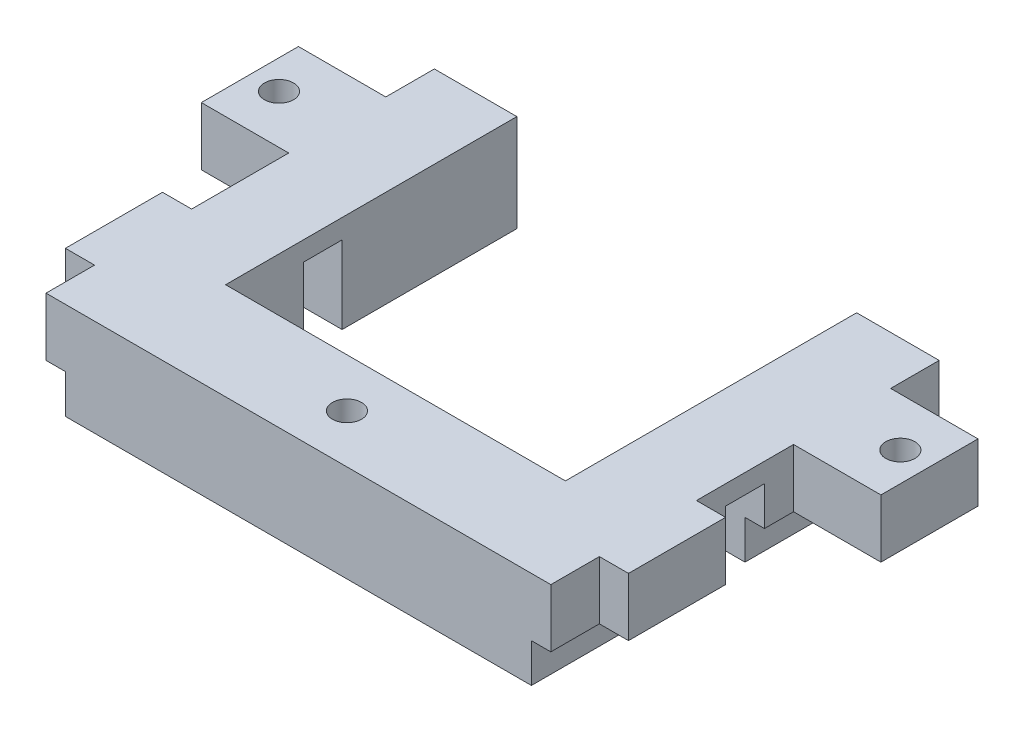
from build123d import *

# Parameters (mm, degrees)
BOSS_EXTRUDE1_DEPTH = 40
SKETCH2_W           = 35
SKETCH2_H           = 30
SKETCH2_W_2         = 3
SKETCH2_H_2         = 10
SKETCH2_H_3         = 5
CUT_EXTRUDE1_DEPTH  = 51.408332645
SKETCH3_W           = 58
SKETCH3_H           = 4
CUT_EXTRUDE2_DEPTH  = 8
SKETCH4_W           = 6
SKETCH4_H           = 10
SKETCH4_R           = 1.5
BOSS_EXTRUDE2_DEPTH = 3
SKETCH5_R           = 1.5
CUT_EXTRUDE3_DEPTH  = 10


with BuildPart() as part:
    # Sketch1 → Boss-Extrude1 (new body)
    with BuildSketch(Plane.XY):
        Polygon((24, -3), (29, -3), (29, 3), (-29, 3), (-29, -3), (-24, -3), (-24, -7), (24, -7), align=None)
    extrude(amount=BOSS_EXTRUDE1_DEPTH)

    # Sketch2 → Cut-Extrude1 (cut, through all)
    with BuildSketch(Plane(origin=(0, 3, 0), x_dir=(1, 0, 0), z_dir=(0, 1, 0))):
        with Locations((0, -15)):
            Rectangle(SKETCH2_W, SKETCH2_H)
        with Locations((27.5, -20)):
            Rectangle(SKETCH2_W_2, SKETCH2_H_2)
        with Locations((-27.5, -20)):
            Rectangle(SKETCH2_W_2, SKETCH2_H_2)
        with Locations((27.5, -37.5)):
            Rectangle(SKETCH2_W_2, SKETCH2_H_3)
        with Locations((-27.5, -37.5)):
            Rectangle(SKETCH2_W_2, SKETCH2_H_3)
        with Locations((-82.5, -20)):
            Rectangle(SKETCH2_W_2, SKETCH2_H_2)
        with Locations((27.5, 0)):
            Rectangle(SKETCH2_W_2, SKETCH2_H_2)
        with Locations((-27.5, 0)):
            Rectangle(SKETCH2_W_2, SKETCH2_H_2)
        with Locations((-82.5, 0)):
            Rectangle(SKETCH2_W_2, SKETCH2_H_2)
    extrude(amount=-CUT_EXTRUDE1_DEPTH, mode=Mode.SUBTRACT)

    # Sketch3 → Cut-Extrude2 (cut)
    with BuildSketch(Plane.XZ.offset(7)):
        with Locations((0, 20)):
            Rectangle(SKETCH3_W, SKETCH3_H)
    extrude(amount=-CUT_EXTRUDE2_DEPTH, mode=Mode.SUBTRACT)

    # Sketch4 → Boss-Extrude2 (add, symmetric)
    with BuildSketch(Plane(origin=(0, 0, 0), x_dir=(1, 0, 0), z_dir=(0, 1, 0))):
        with Locations((32, -10)):
            Rectangle(SKETCH4_W, SKETCH4_H)
        with Locations((32, -10)):
            Circle(SKETCH4_R, mode=Mode.SUBTRACT)
    boss_extrude2 = extrude(amount=BOSS_EXTRUDE2_DEPTH, both=True)

    # Mirror1: Boss-Extrude2 across plane
    add(boss_extrude2.mirror(Plane(origin=(0, 0, 0), x_dir=(0, 0, 1), z_dir=(1, 0, 0))))

    # Sketch5 → Cut-Extrude3 (cut)
    with BuildSketch(Plane(origin=(0, 3, 0), x_dir=(1, 0, 0), z_dir=(0, 1, 0))):
        with Locations((0, -35)):
            Circle(SKETCH5_R)
    extrude(amount=-CUT_EXTRUDE3_DEPTH, mode=Mode.SUBTRACT)


solid = part.part
